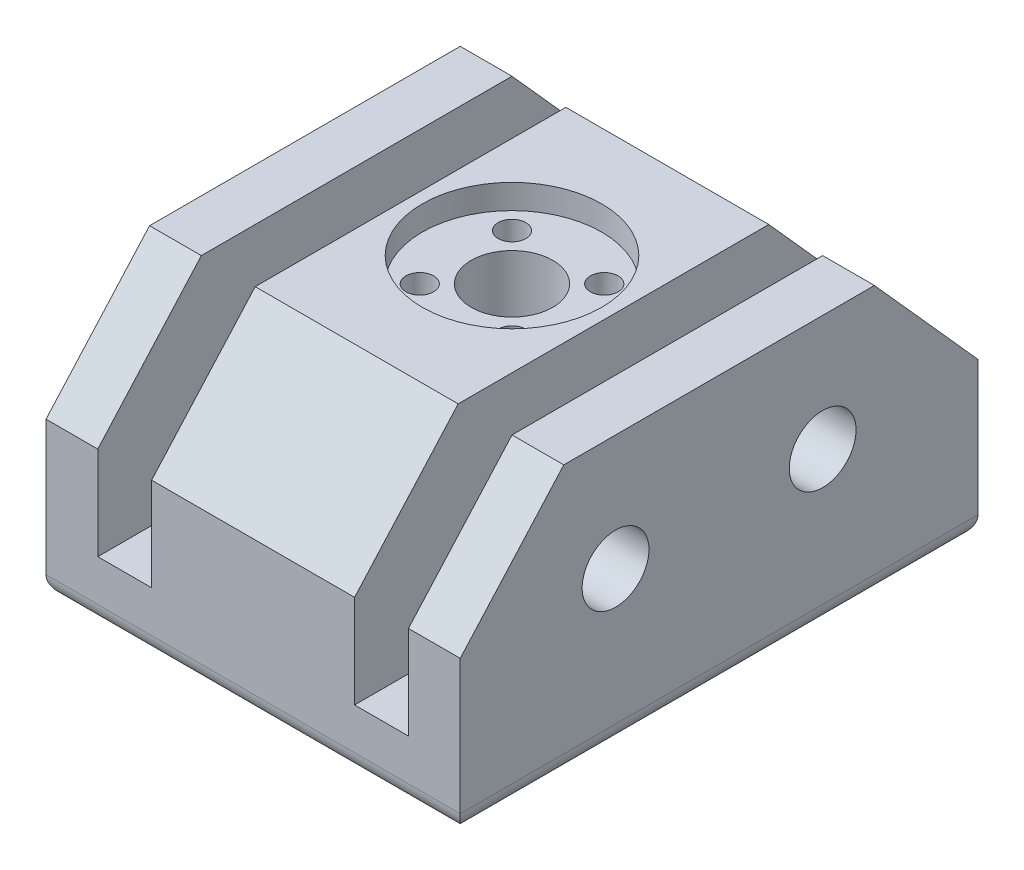
from build123d import *

# Parameters (mm, degrees)
SKETCH1_W           = 63.5
SKETCH1_H           = 6.35
BOSS_EXTRUDE1_DEPTH = 50.8
BOSS_EXTRUDE2_DEPTH = 50.8
SKETCH10_W          = 6.604
SKETCH10_H          = 25.629031657
CUT_EXTRUDE1_DEPTH  = 88.854357354
LPATTERN3_COUNT     = 2
LPATTERN3_PITCH     = 31.496
SKETCH11_R          = 4.09575
CUT_EXTRUDE2_DEPTH  = 88.854357354
FILLET1_R           = 2.54
CUT_EXTRUDE7_REACH  = 89.854
SKETCH21_R          = 1.700000029
SKETCH22_R          = 11
CUT_EXTRUDE8_DEPTH  = 3
SKETCH24_R          = 5
CUT_EXTRUDE10_DEPTH = 88.854357354


with BuildPart() as part:
    # Sketch1 → Boss-Extrude1 (new body)
    with BuildSketch(Plane(origin=(0, 0, 0), x_dir=(0, 0, -1), z_dir=(1, 0, 0))):
        with Locations((31.75, 3.175)):
            Rectangle(SKETCH1_W, SKETCH1_H)
    extrude(amount=-BOSS_EXTRUDE1_DEPTH)

    # Sketch2 → Boss-Extrude2 (add)
    with BuildSketch(Plane(origin=(0, 0, 0), x_dir=(0, 0, -1), z_dir=(1, 0, 0))):
        Polygon((0, 6.35), (0, 19.05), (12.7, 33.249031657), (50.8, 33.249031657), (63.5, 19.05), (63.5, 6.35), align=None)
    extrude(amount=-BOSS_EXTRUDE2_DEPTH)

    # Sketch10 → Cut-Extrude1 (cut, through all)
    with BuildSketch(Plane(origin=(0, 0, -63.5), x_dir=(-1, 0, 0), z_dir=(0, 0, -1))):
        with Locations((9.652, 20.434515829)):
            Rectangle(SKETCH10_W, SKETCH10_H)
    cut_extrude1 = extrude(amount=-CUT_EXTRUDE1_DEPTH, mode=Mode.SUBTRACT)

    # LPattern3: Cut-Extrude1 ×2
    with Locations(*[(-i * LPATTERN3_PITCH, 0, 0) for i in range(1, LPATTERN3_COUNT)]):
        add(cut_extrude1, mode=Mode.SUBTRACT)

    # Sketch11 → Cut-Extrude2 (cut, through all)
    with BuildSketch(Plane(origin=(0, 0, 0), x_dir=(0, 0, -1), z_dir=(1, 0, 0))):
        with Locations((19.05, 19.05)):
            Circle(SKETCH11_R)
        with Locations((44.45, 19.05)):
            Circle(SKETCH11_R)
    extrude(amount=-CUT_EXTRUDE2_DEPTH, mode=Mode.SUBTRACT)

    # Fillet1
    fillet1_edges = [part.edges().sort_by_distance(p)[0] for p in [
        (0, 0, -31.75),
        (-50.8, 0, -31.75),
        (-25.4, 0, 0),
        (-25.4, 0, -63.5),
    ]]
    fillet(fillet1_edges, radius=FILLET1_R)

    # Sketch21 → Cut-Extrude7 (cut, up to next)
    with BuildSketch(Plane.XZ, mode=Mode.PRIVATE) as cut_extrude7_sk1:
        with Locations((-31.056854284, -37.406854215)):
            Circle(SKETCH21_R)
    cut_extrude7_tool1 = extrude(cut_extrude7_sk1.sketch, amount=-CUT_EXTRUDE7_REACH, mode=Mode.PRIVATE) & part.part
    # Sketch21 → Cut-Extrude7 (cut, up to next)
    with BuildSketch(Plane.XZ, mode=Mode.PRIVATE) as cut_extrude7_sk2:
        with Locations((-31.056854215, -26.093145716)):
            Circle(SKETCH21_R)
    cut_extrude7_tool2 = extrude(cut_extrude7_sk2.sketch, amount=-CUT_EXTRUDE7_REACH, mode=Mode.PRIVATE) & part.part
    # Sketch21 → Cut-Extrude7 (cut, up to next)
    with BuildSketch(Plane.XZ, mode=Mode.PRIVATE) as cut_extrude7_sk3:
        with Locations((-19.743145716, -26.093145785)):
            Circle(SKETCH21_R)
    cut_extrude7_tool3 = extrude(cut_extrude7_sk3.sketch, amount=-CUT_EXTRUDE7_REACH, mode=Mode.PRIVATE) & part.part
    # Sketch21 → Cut-Extrude7 (cut, up to next)
    with BuildSketch(Plane.XZ, mode=Mode.PRIVATE) as cut_extrude7_sk4:
        with Locations((-19.743145785, -37.406854284)):
            Circle(SKETCH21_R)
    cut_extrude7_tool4 = extrude(cut_extrude7_sk4.sketch, amount=-CUT_EXTRUDE7_REACH, mode=Mode.PRIVATE) & part.part
    add(cut_extrude7_tool1.solids().sort_by_distance((-31.056854, 0, -37.406854))[0], mode=Mode.SUBTRACT)
    add(cut_extrude7_tool2.solids().sort_by_distance((-31.056854, 0, -26.093146))[0], mode=Mode.SUBTRACT)
    add(cut_extrude7_tool3.solids().sort_by_distance((-19.743146, 0, -26.093146))[0], mode=Mode.SUBTRACT)
    add(cut_extrude7_tool4.solids().sort_by_distance((-19.743146, 0, -37.406854))[0], mode=Mode.SUBTRACT)

    # Sketch22 → Cut-Extrude8 (cut)
    with BuildSketch(Plane.XZ.offset(-33.249031657)):
        with Locations((-25.4, -31.75)):
            Circle(SKETCH22_R)
    extrude(amount=CUT_EXTRUDE8_DEPTH, mode=Mode.SUBTRACT)

    # Sketch24 → Cut-Extrude10 (cut, through all)
    with BuildSketch(Plane.XZ):
        with Locations((-25.4, -31.75)):
            Circle(SKETCH24_R)
    extrude(amount=-CUT_EXTRUDE10_DEPTH, mode=Mode.SUBTRACT)


solid = part.part
